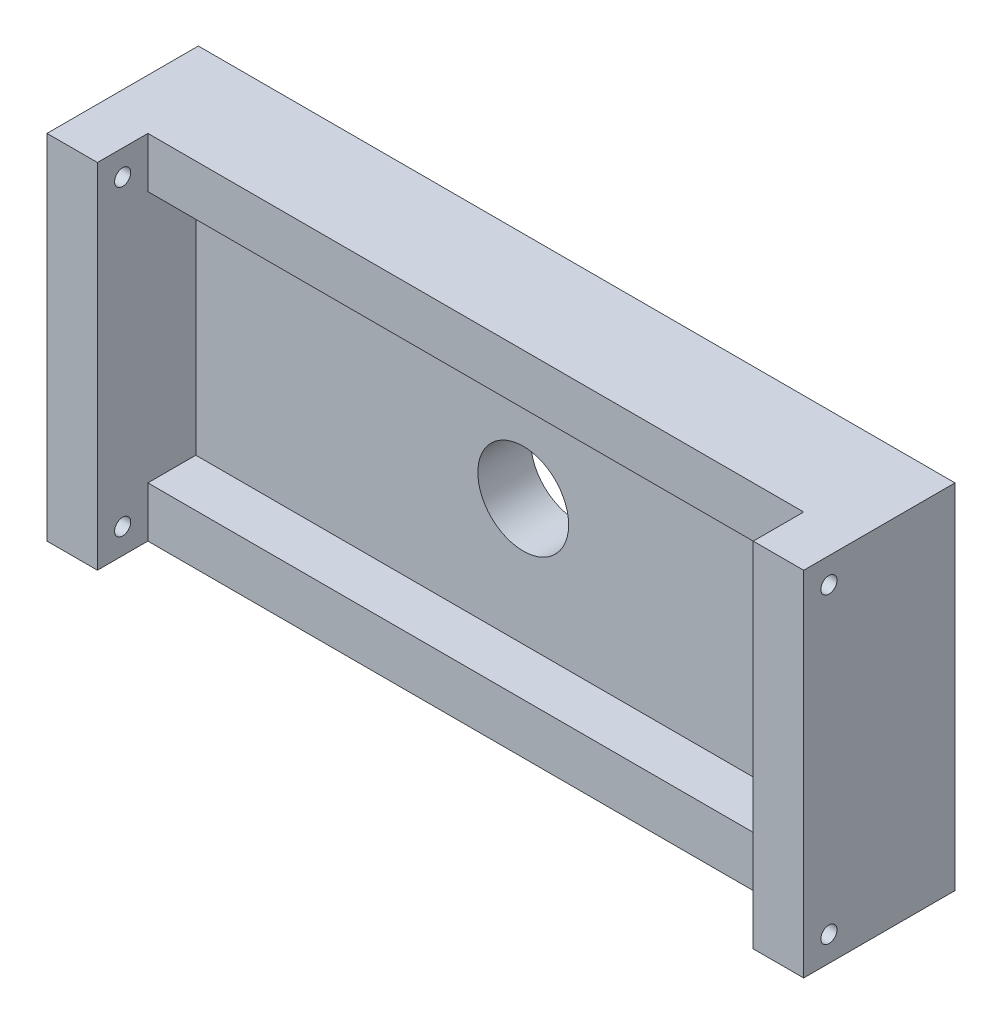
from build123d import *

# Parameters (mm, degrees)
SKETCH1_R               = 5
BOSS_EXTRUDE1_DEPTH     = 70
SKETCH3_W               = 50
SKETCH3_H               = 30
CUT_EXTRUDE1_DEPTH      = 175.114904589
SKETCH6_W               = 130
SKETCH6_H               = 50
CUT_EXTRUDE2_DEPTH      = 19.5
SKETCH7_R               = 9
CUT_EXTRUDE3_DEPTH      = 109.237008458
SKETCH8_W               = 34.830665203
SKETCH8_H               = 70
CUT_EXTRUDE4_DEPTH      = 175.114904589
SKETCH9_W               = 130
SKETCH9_H               = 10
CUT_EXTRUDE5_DEPTH      = 107.887791632
CUT_EXTRUDE6_DEPTH      = 160.373774505
CUT_EXTRUDE6_DEPTH_BACK = 160.373774505
SKETCH12_R              = 1.6


with BuildPart() as part:
    # Sketch1 → Boss-Extrude1 (new body)
    with BuildSketch(Plane(origin=(0, 0, 0), x_dir=(1, 0, 0), z_dir=(0, 1, 0))):
        with BuildLine():
            Line((-75, 0), (75, 0))
            Line((75, 0), (75, 30))
            Line((75, 30), (69.5, 30))
            Line((69.5, 30), (69.5, 42))
            ThreePointArc((69.5, 42), (57.5, 54), (45.5, 42))
            Line((45.5, 42), (45.5, 30))
            Line((45.5, 30), (-45.5, 30))
            Line((-45.5, 30), (-45.5, 42))
            ThreePointArc((-45.5, 42), (-57.5, 54), (-69.5, 42))
            Line((-69.5, 42), (-69.5, 30))
            Line((-69.5, 30), (-75, 30))
            Line((-75, 30), (-75, 0))
        make_face()
        with Locations((57.5, 42)):
            Circle(SKETCH1_R, mode=Mode.SUBTRACT)
        with Locations((-57.5, 42)):
            Circle(SKETCH1_R, mode=Mode.SUBTRACT)
    extrude(amount=BOSS_EXTRUDE1_DEPTH)

    # Sketch3 → Cut-Extrude1 (cut, through all)
    with BuildSketch(Plane.ZY.offset(75)):
        with Locations((-55, 15)):
            Rectangle(SKETCH3_W, SKETCH3_H)
    extrude(amount=-CUT_EXTRUDE1_DEPTH, mode=Mode.SUBTRACT)

    # Sketch6 → Cut-Extrude2 (cut)
    with BuildSketch(Plane.XY):
        with Locations((0, 35)):
            Rectangle(SKETCH6_W, SKETCH6_H)
    extrude(amount=-CUT_EXTRUDE2_DEPTH, mode=Mode.SUBTRACT)

    # Sketch7 → Cut-Extrude3 (cut, through all)
    with BuildSketch(Plane.XY.offset(-19.5)):
        with Locations((-0.094237072, 35)):
            Circle(SKETCH7_R)
    extrude(amount=-CUT_EXTRUDE3_DEPTH, mode=Mode.SUBTRACT)

    # Sketch8 → Cut-Extrude4 (cut, through all)
    with BuildSketch(Plane(origin=(75, 0, 0), x_dir=(0, 0, -1), z_dir=(1, 0, 0))):
        with Locations((47.415332602, 35)):
            Rectangle(SKETCH8_W, SKETCH8_H)
    extrude(amount=-CUT_EXTRUDE4_DEPTH, mode=Mode.SUBTRACT)

    # Sketch9 → Cut-Extrude5 (cut, through all)
    with BuildSketch(Plane(origin=(0, 70, 0), x_dir=(1, 0, 0), z_dir=(0, 1, 0))):
        with Locations((0, 5)):
            Rectangle(SKETCH9_W, SKETCH9_H)
    extrude(amount=-CUT_EXTRUDE5_DEPTH, mode=Mode.SUBTRACT)

    # Sketch12 → Cut-Extrude6 (cut, two sides: drawn at the far end of the back side and taken through both)
    with BuildSketch(Plane.ZY.offset(-65).offset(-CUT_EXTRUDE6_DEPTH_BACK)):
        with Locations((-5, 65)):
            Circle(SKETCH12_R)
        with Locations((-5, 5)):
            Circle(SKETCH12_R)
    extrude(amount=CUT_EXTRUDE6_DEPTH + CUT_EXTRUDE6_DEPTH_BACK, mode=Mode.SUBTRACT)


solid = part.part
